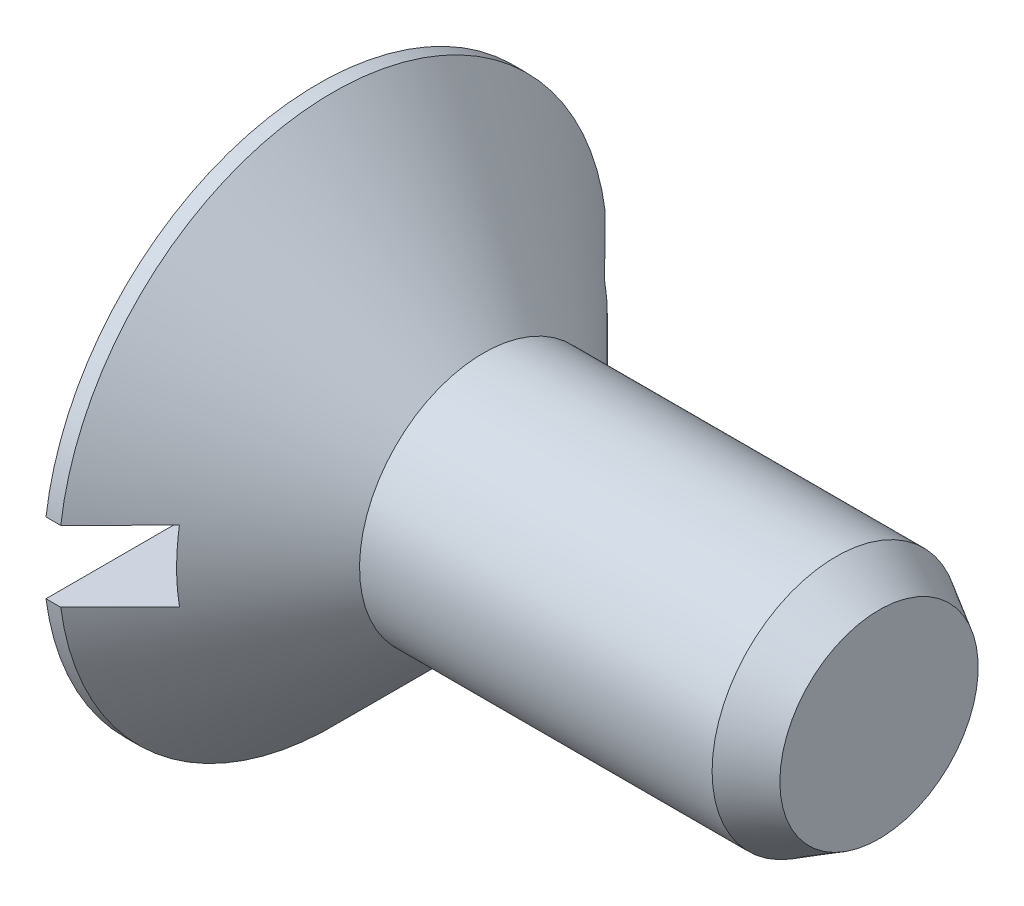
from build123d import *

# Parameters (mm, degrees)
CUT_EXTRUDE1_DEPTH      = 12.554003635
CUT_EXTRUDE1_DEPTH_BACK = 12.554003635
SKETCH2_W               = 1.25
SKETCH2_H               = 1.2
CHAMFER1_SIZE           = 0.42
CHAMFER1_SIZE2          = 0.727461339


with BuildPart() as part:
    # Sketch1 → Revolve1 (revolve)
    with BuildSketch(Plane.XY):
        Polygon((0, 4.65), (0.25, 4.65), (2.8, 2.1), (9.5, 2.1), (9.5, 0), (0, 0), align=None)
    revolve(axis=Axis((6.620684694, 0, 0), (-1, 0, 0)))

    # Sketch2 → Cut-Extrude1 (cut, two sides: drawn at the far end of the back side and taken through both)
    with BuildSketch(Plane.XY.offset(-CUT_EXTRUDE1_DEPTH_BACK)):
        with Locations((0.625, 0)):
            Rectangle(SKETCH2_W, SKETCH2_H)
    extrude(amount=CUT_EXTRUDE1_DEPTH + CUT_EXTRUDE1_DEPTH_BACK, mode=Mode.SUBTRACT)

    # Chamfer1
    chamfer1_edges = [part.edges().sort_by_distance(p)[0] for p in [
        (9.5, -2.1, 0),
    ]]
    chamfer1_side = [part.faces().sort_by_distance(p)[0] for p in [
        (9.5, 0, 0),
    ]]
    chamfer(chamfer1_edges, length=CHAMFER1_SIZE, length2=CHAMFER1_SIZE2, reference=chamfer1_side[0])


solid = part.part
